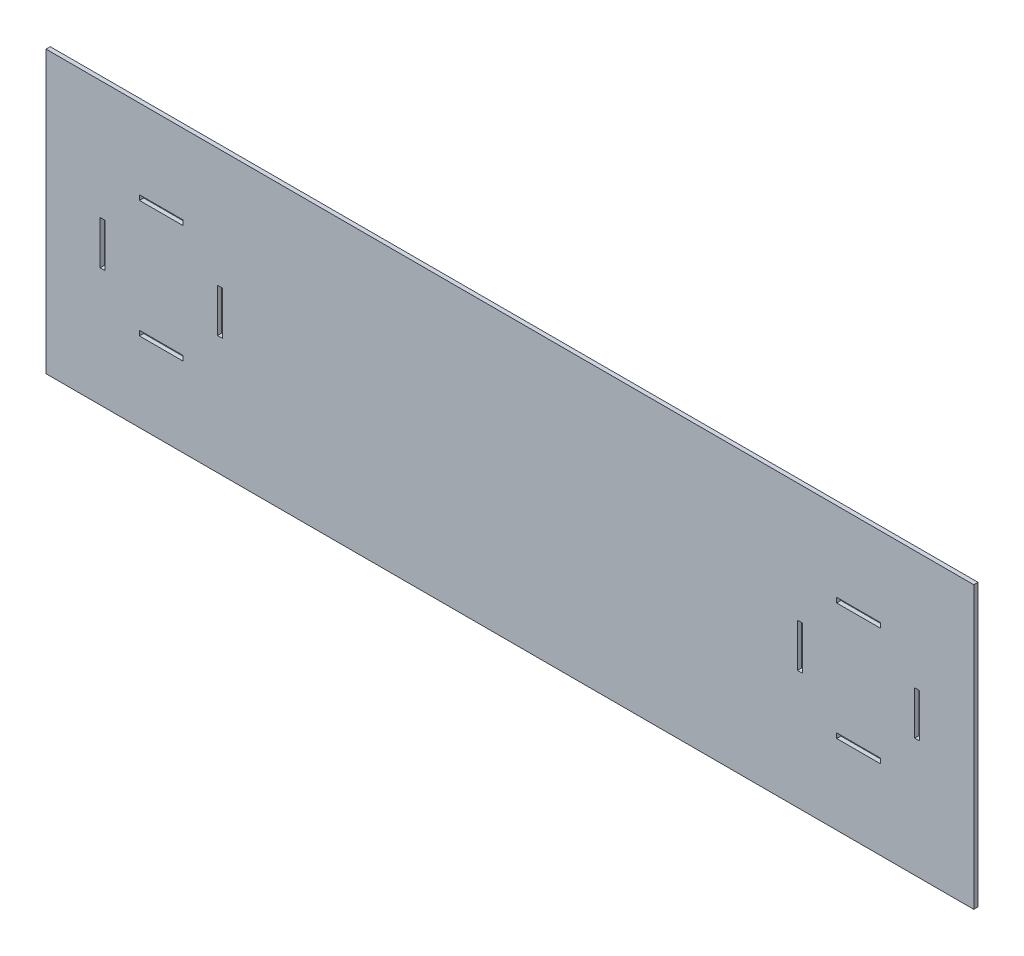
from build123d import *

# Parameters (mm, degrees)
ESBO_O1_W                = 660
ESBO_O1_H                = 200
RESSALTO_EXTRUS_O1_DEPTH = 3
ESBO_O2_W                = 3.5
ESBO_O2_H                = 31
ESBO_O2_W_2              = 31
ESBO_O2_H_2              = 3.5
CORTE_EXTRUS_O1_DEPTH    = 345.831843077


with BuildPart() as part:
    # Esboço1 → Ressalto-extrusão1 (new body)
    with BuildSketch(Plane.XY):
        Rectangle(ESBO_O1_W, ESBO_O1_H)
    extrude(amount=RESSALTO_EXTRUS_O1_DEPTH)

    # Esboço2 → Corte-extrusão1 (cut, through all)
    with BuildSketch(Plane.XY.offset(3)):
        with Locations((289.75, 0)):
            Rectangle(ESBO_O2_W, ESBO_O2_H)
        with Locations((-206.25, 0)):
            Rectangle(ESBO_O2_W, ESBO_O2_H)
        with Locations((-289.75, 0)):
            Rectangle(ESBO_O2_W, ESBO_O2_H)
        with Locations((-248, 41.75)):
            Rectangle(ESBO_O2_W_2, ESBO_O2_H_2)
        with Locations((-248, -41.75)):
            Rectangle(ESBO_O2_W_2, ESBO_O2_H_2)
        with Locations((206.25, 0)):
            Rectangle(ESBO_O2_W, ESBO_O2_H)
        with Locations((248, -41.75)):
            Rectangle(ESBO_O2_W_2, ESBO_O2_H_2)
        with Locations((248, 41.75)):
            Rectangle(ESBO_O2_W_2, ESBO_O2_H_2)
    extrude(amount=-CORTE_EXTRUS_O1_DEPTH, mode=Mode.SUBTRACT)


solid = part.part
